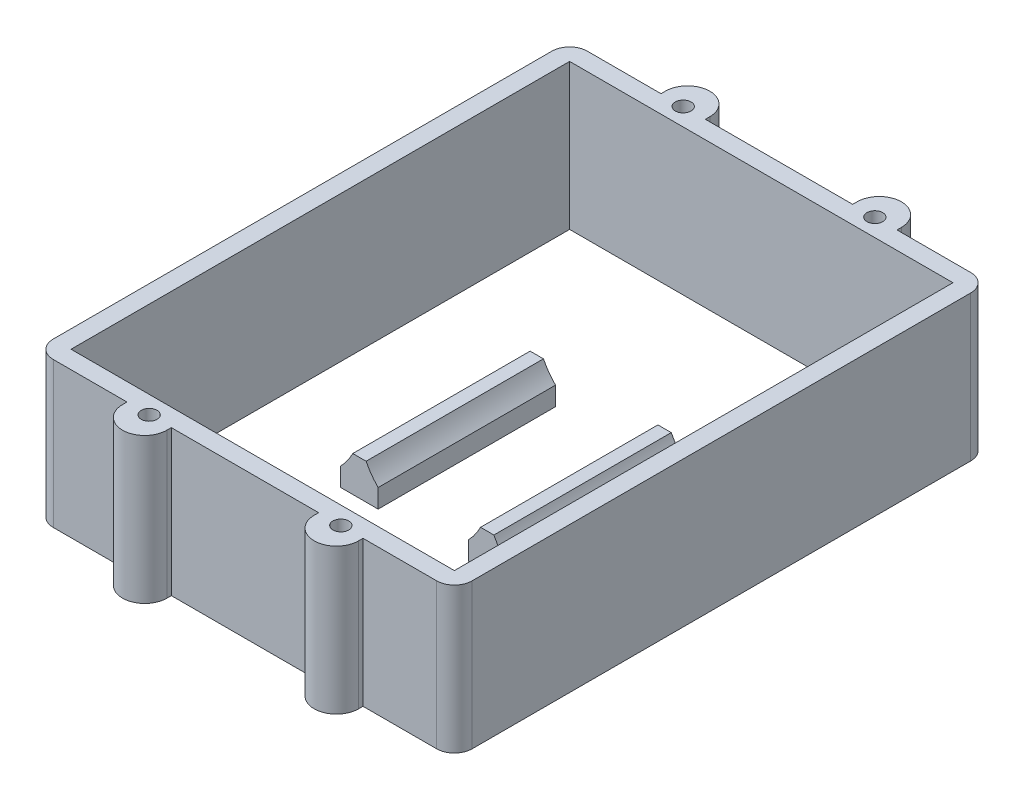
from build123d import *

# Parameters (mm, degrees)
BOSS_EXTRUDE1_OUTLINE_W        = 59.98
BOSS_EXTRUDE1_OUTLINE_H        = 76.48
BOSS_EXTRUDE1_OUTLINE_W_2      = 54.9
BOSS_EXTRUDE1_OUTLINE_H_2      = 71.4
BOSS_EXTRUDE1_DEPTH            = 20.839999976
BOSS_EXTRUDE2_DEPTH            = 12.7
LPATTERN2_COUNT                = 2
LPATTERN2_PITCH                = 18.3
SKETCH6_W                      = 6.35
SKETCH6_H                      = 3.81
BOSS_EXTRUDE3_DEPTH            = 20.839999976
MIRROR2_COPY_1_SKETCH_W        = 6.35
MIRROR2_COPY_1_SKETCH_H        = 3.81
MIRROR2_COPY_1_DEPTH           = 20.839999976
F_4_40_TAPPED_HOLE1_AT_2_COUNT = 2
F_4_40_TAPPED_HOLE1_AT_2_PITCH = 27.45
F_4_40_TAPPED_HOLE1_AT_3_COUNT = 2
F_4_40_TAPPED_HOLE1_AT_3_PITCH = 81.25695601
F_4_40_TAPPED_HOLE1_AT_4_COUNT = 2
F_4_40_TAPPED_HOLE1_AT_4_PITCH = 76.48
FILLET1_RADIUS                 = 3.175
FILLET1_LENGTH                 = 20.839999976
FILLET2_RADIUS                 = 3.175
FILLET2_LENGTH                 = 20.839999976
FILLET3_RADIUS                 = 3.175
FILLET3_LENGTH                 = 20.839999976
FILLET4_RADIUS                 = 3.175
FILLET4_LENGTH                 = 20.839999976
FILLET5_R                      = 2.54


# Read off the part's stored shape, not the designer's step: Boss-Extrude1
with BuildPart() as part:
    # Boss-Extrude1 outline → Boss-Extrude1 (new body)
    with BuildSketch(Plane(origin=(0, 0, 0), x_dir=(1, 0, 0), z_dir=(0, 1, 0))):
        Rectangle(BOSS_EXTRUDE1_OUTLINE_W, BOSS_EXTRUDE1_OUTLINE_H)
        Rectangle(BOSS_EXTRUDE1_OUTLINE_W_2, BOSS_EXTRUDE1_OUTLINE_H_2, mode=Mode.SUBTRACT)
    extrude(amount=BOSS_EXTRUDE1_DEPTH)

    # Sketch6 → Boss-Extrude3 (add)
    with BuildSketch(Plane(origin=(0, 20.839999976, 0), x_dir=(1, 0, 0), z_dir=(0, 1, 0))):
        with Locations((-13.725, 40.145)):
            Rectangle(SKETCH6_W, SKETCH6_H)
    boss_extrude3 = extrude(amount=-BOSS_EXTRUDE3_DEPTH)

    # Mirror1: Boss-Extrude3 across plane
    add(boss_extrude3.mirror(Plane(origin=(0, 0, 0), x_dir=(0, 0, 1), z_dir=(1, 0, 0))))

    # Mirror2: Boss-Extrude3 across plane
    add(boss_extrude3.mirror(Plane.XY))

    # Mirror2 copy 1 sketch → Mirror2 copy 1 (add)
    with BuildSketch(Plane(origin=(0, 20.839999976, 0), x_dir=(-1, 0, 0), z_dir=(0, 1, 0))):
        with Locations((-13.725, 40.145)):
            Rectangle(MIRROR2_COPY_1_SKETCH_W, MIRROR2_COPY_1_SKETCH_H)
    extrude(amount=-MIRROR2_COPY_1_DEPTH)

    # Sketch7 → #4-40 Tapped Hole1 (revolve, cut)
    with BuildSketch(Plane(origin=(-13.725, 20.839999976, -38.24), x_dir=(0, 0, 1), z_dir=(1, 0, 0))):
        Polygon((0, 0), (0, 8.299152758), (1.1303, 7.62), (1.1303, 0), align=None)
    f_4_40_tapped_hole1 = revolve(axis=Axis((-13.725, 27.189999976, -38.24), (0, -1, 0)), mode=Mode.SUBTRACT)

    # #4-40 Tapped Hole1 at 2: #4-40 Tapped Hole1 ×2
    with Locations(*[(i * F_4_40_TAPPED_HOLE1_AT_2_PITCH, 0, 0) for i in range(1, F_4_40_TAPPED_HOLE1_AT_2_COUNT)]):
        add(f_4_40_tapped_hole1, mode=Mode.SUBTRACT)

    # #4-40 Tapped Hole1 at 3: #4-40 Tapped Hole1 ×2
    with Locations(*[Vector(0.3378172324920079, 0, 0.9412117282691715) * (i * F_4_40_TAPPED_HOLE1_AT_3_PITCH) for i in range(1, F_4_40_TAPPED_HOLE1_AT_3_COUNT)]):
        add(f_4_40_tapped_hole1, mode=Mode.SUBTRACT)

    # #4-40 Tapped Hole1 at 4: #4-40 Tapped Hole1 ×2
    with Locations(*[(0, 0, i * F_4_40_TAPPED_HOLE1_AT_4_PITCH) for i in range(1, F_4_40_TAPPED_HOLE1_AT_4_COUNT)]):
        add(f_4_40_tapped_hole1, mode=Mode.SUBTRACT)

    # Fillet1: full round fillet: the end face becomes a half cylinder, R = half its width
    fillet1_face = Plane((-13.725, 10.419999988, -42.05), x_dir=(0, -1, 0), z_dir=(0, 0, -1))  # on the end face: x along it, z out of the body
    fillet1_slab = fillet1_face.offset(-FILLET1_RADIUS / 2) * Box(FILLET1_LENGTH, 2 * FILLET1_RADIUS, FILLET1_RADIUS, mode=Mode.PRIVATE)  # the body's end, R deep
    fillet1_round = Plane((-13.725, 10.419999988, -38.875), x_dir=(0, 0, -1), z_dir=(0, -1, 0)) * Cylinder(FILLET1_RADIUS, FILLET1_LENGTH, mode=Mode.PRIVATE)  # its axis R under the face
    add(fillet1_slab - fillet1_round, mode=Mode.SUBTRACT)

    # Fillet2: full round fillet: the end face becomes a half cylinder, R = half its width
    fillet2_face = Plane((13.725, 10.419999988, -42.05), x_dir=(0, -1, 0), z_dir=(0, 0, -1))  # on the end face: x along it, z out of the body
    fillet2_slab = fillet2_face.offset(-FILLET2_RADIUS / 2) * Box(FILLET2_LENGTH, 2 * FILLET2_RADIUS, FILLET2_RADIUS, mode=Mode.PRIVATE)  # the body's end, R deep
    fillet2_round = Plane((13.725, 10.419999988, -38.875), x_dir=(0, 0, -1), z_dir=(0, -1, 0)) * Cylinder(FILLET2_RADIUS, FILLET2_LENGTH, mode=Mode.PRIVATE)  # its axis R under the face
    add(fillet2_slab - fillet2_round, mode=Mode.SUBTRACT)

    # Fillet3: full round fillet: the end face becomes a half cylinder, R = half its width
    fillet3_face = Plane((13.725, 10.419999988, 42.05), x_dir=(0, -1, 0), z_dir=(0, 0, 1))  # on the end face: x along it, z out of the body
    fillet3_slab = fillet3_face.offset(-FILLET3_RADIUS / 2) * Box(FILLET3_LENGTH, 2 * FILLET3_RADIUS, FILLET3_RADIUS, mode=Mode.PRIVATE)  # the body's end, R deep
    fillet3_round = Plane((13.725, 10.419999988, 38.875), x_dir=(0, 0, 1), z_dir=(0, -1, 0)) * Cylinder(FILLET3_RADIUS, FILLET3_LENGTH, mode=Mode.PRIVATE)  # its axis R under the face
    add(fillet3_slab - fillet3_round, mode=Mode.SUBTRACT)

    # Fillet4: full round fillet: the end face becomes a half cylinder, R = half its width
    fillet4_face = Plane((-13.725, 10.419999988, 42.05), x_dir=(0, -1, 0), z_dir=(0, 0, 1))  # on the end face: x along it, z out of the body
    fillet4_slab = fillet4_face.offset(-FILLET4_RADIUS / 2) * Box(FILLET4_LENGTH, 2 * FILLET4_RADIUS, FILLET4_RADIUS, mode=Mode.PRIVATE)  # the body's end, R deep
    fillet4_round = Plane((-13.725, 10.419999988, 38.875), x_dir=(0, 0, 1), z_dir=(0, -1, 0)) * Cylinder(FILLET4_RADIUS, FILLET4_LENGTH, mode=Mode.PRIVATE)  # its axis R under the face
    add(fillet4_slab - fillet4_round, mode=Mode.SUBTRACT)

    # Fillet5
    fillet5_edges = [part.edges().sort_by_distance(p)[0] for p in [
        (29.99, 10.419999988, 38.24),
        (29.99, 10.419999988, -38.24),
        (-29.99, 10.419999988, -38.24),
        (-29.99, 10.419999988, 38.24),
    ]]
    fillet(fillet5_edges, radius=FILLET5_R)


with BuildPart() as body_2:
    # Sketch4 → Boss-Extrude2 (new, symmetric)
    with BuildSketch(Plane.XY):
        with BuildLine():
            Line((-11.829972952, 0), (-6.470027048, 0))
            Line((-6.470027048, 0), (-6.470027048, 2.679972952))
            ThreePointArc((-6.470027048, 2.679972952), (-7.430046898, 3.809877988), (-8.19497407, 5.08))
            Line((-8.19497407, 5.08), (-10.10502593, 5.08))
            ThreePointArc((-10.10502593, 5.08), (-10.869953102, 3.809877988), (-11.829972952, 2.679972952))
            Line((-11.829972952, 2.679972952), (-11.829972952, 0))
        make_face()
    extrude(amount=BOSS_EXTRUDE2_DEPTH, both=True)


with BuildPart() as lpattern2_1:
    # LPattern2: pattern copy
    add(body_2.part.moved(Location(Vector(1, 0, 0) * (1 * LPATTERN2_PITCH))))


solid = Compound([part.part, body_2.part, lpattern2_1.part])
